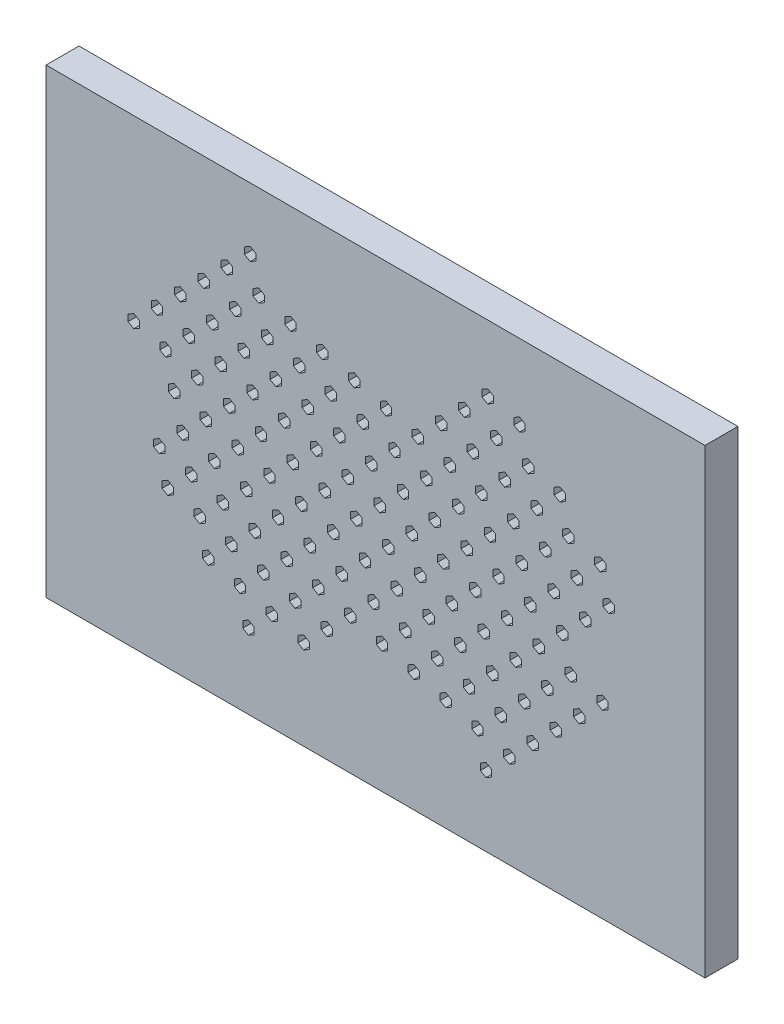
from build123d import *

# Parameters (mm, degrees)
SKICA1_W                 = 200
SKICA1_H                 = 140
P_IDAT_VYSUNUT_M1_DEPTH  = 10
ODEBRAT_VYSUNUT_M2_REACH = 124.474
POLE_VYPLN_N_M1_DEPTH    = 10


# Read off the part's stored shape, not the designer's step: Pole vyplněním1
with BuildPart() as part:
    # Skica1 → Přidat vysunutím1 (new body)
    with BuildSketch(Plane.XY):
        Rectangle(SKICA1_W, SKICA1_H)
    extrude(amount=P_IDAT_VYSUNUT_M1_DEPTH)

    # Skica3 → Odebrat vysunutím2 (cut, up to next)
    with BuildSketch(Plane.XY.offset(10), mode=Mode.PRIVATE) as odebrat_vysunut_m2_sk1:
        Polygon((-71.673091376, 14.9613897), (-71.673091376, 16.9613897), (-73.405142184, 17.9613897), (-75.137192991, 16.9613897), (-75.137192991, 14.9613897), (-73.405142184, 13.9613897), align=None)
    odebrat_vysunut_m2_tool1 = extrude(odebrat_vysunut_m2_sk1.sketch, amount=-ODEBRAT_VYSUNUT_M2_REACH, mode=Mode.PRIVATE) & part.part
    add(odebrat_vysunut_m2_tool1.solids().sort_by_distance((-73.405142, 15.96139, 10))[0], mode=Mode.SUBTRACT)

    # Pole vyplněním1 outline → Pole vyplněním1 (cut)
    with BuildSketch(Plane.XY):
        Polygon((-64.784431187, -23.675643352), (-63.05238038, -24.675643352), (-61.320329572, -23.675643352), (-61.320329572, -21.675643352), (-63.05238038, -20.675643352), (-64.784431187, -21.675643352), align=None)
        Polygon((66.46998696, 21.846633798), (68.202037767, 20.846633798), (69.934088575, 21.846633798), (69.934088575, 23.846633798), (68.202037767, 24.846633798), (66.46998696, 23.846633798), align=None)
        Polygon((-26.840901677, 2.020437445), (-25.108850869, 1.020437445), (-23.376800062, 2.020437445), (-23.376800062, 4.020437445), (-25.108850869, 5.020437445), (-26.840901677, 4.020437445), align=None)
        Polygon((-29.429092128, 11.679695708), (-27.69704132, 10.679695708), (-25.964990513, 11.679695708), (-25.964990513, 13.679695708), (-27.69704132, 14.679695708), (-29.429092128, 13.679695708), align=None)
        Polygon((-32.017282579, 21.338953971), (-30.285231771, 20.338953971), (-28.553180964, 21.338953971), (-28.553180964, 23.338953971), (-30.285231771, 24.338953971), (-32.017282579, 23.338953971), align=None)
        Polygon((-34.60547303, 30.998212233), (-32.873422222, 29.998212233), (-31.141371415, 30.998212233), (-31.141371415, 32.998212233), (-32.873422222, 33.998212233), (-34.60547303, 32.998212233), align=None)
        Polygon((-37.193663481, 40.657470496), (-35.461612673, 39.657470496), (-33.729561866, 40.657470496), (-33.729561866, 42.657470496), (-35.461612673, 43.657470496), (-37.193663481, 42.657470496), align=None)
        Polygon((-39.781853932, 50.316728759), (-38.049803124, 49.316728759), (-36.317752317, 50.316728759), (-36.317752317, 52.316728759), (-38.049803124, 53.316728759), (-39.781853932, 52.316728759), align=None)
        Polygon((-9.417072061, -29.545527795), (-7.685021253, -30.545527795), (-5.952970446, -29.545527795), (-5.952970446, -27.545527795), (-7.685021253, -26.545527795), (-9.417072061, -27.545527795), align=None)
        Polygon((-12.005262512, -19.886269532), (-10.273211704, -20.886269532), (-8.541160897, -19.886269532), (-8.541160897, -17.886269532), (-10.273211704, -16.886269532), (-12.005262512, -17.886269532), align=None)
        Polygon((-24.252711226, -7.638820818), (-22.520660418, -8.638820818), (-20.788609611, -7.638820818), (-20.788609611, -5.638820818), (-22.520660418, -4.638820818), (-24.252711226, -5.638820818), align=None)
        Polygon((-21.664520775, -17.298079081), (-19.932469967, -18.298079081), (-18.20041916, -17.298079081), (-18.20041916, -15.298079081), (-19.932469967, -14.298079081), (-21.664520775, -15.298079081), align=None)
        Polygon((-19.076330324, -26.957337344), (-17.344279516, -27.957337344), (-15.612228709, -26.957337344), (-15.612228709, -24.957337344), (-17.344279516, -23.957337344), (-19.076330324, -24.957337344), align=None)
        Polygon((-16.488139873, -36.616595607), (-14.756089065, -37.616595607), (-13.024038258, -36.616595607), (-13.024038258, -34.616595607), (-14.756089065, -33.616595607), (-16.488139873, -34.616595607), align=None)
        Polygon((-46.852921744, 43.245660947), (-45.120870936, 42.245660947), (-43.388820129, 43.245660947), (-43.388820129, 45.245660947), (-45.120870936, 46.245660947), (-46.852921744, 45.245660947), align=None)
        Polygon((-44.264731293, 33.586402684), (-42.532680485, 32.586402684), (-40.800629678, 33.586402684), (-40.800629678, 35.586402684), (-42.532680485, 36.586402684), (-44.264731293, 35.586402684), align=None)
        Polygon((-41.676540842, 23.927144422), (-39.944490034, 22.927144422), (-38.212439227, 23.927144422), (-38.212439227, 25.927144422), (-39.944490034, 26.927144422), (-41.676540842, 25.927144422), align=None)
        Polygon((-39.088350391, 14.267886159), (-37.356299583, 13.267886159), (-35.624248776, 14.267886159), (-35.624248776, 16.267886159), (-37.356299583, 17.267886159), (-39.088350391, 16.267886159), align=None)
        Polygon((-4.9341947, -12.81520172), (-3.202143893, -13.81520172), (-1.470093085, -12.81520172), (-1.470093085, -10.81520172), (-3.202143893, -9.81520172), (-4.9341947, -10.81520172), align=None)
        Polygon((-7.522385151, -3.155943457), (-5.790334344, -4.155943457), (-4.058283536, -3.155943457), (-4.058283536, -1.155943457), (-5.790334344, -0.155943457), (-7.522385151, -1.155943457), align=None)
        Polygon((-10.110575602, 6.503314806), (-8.378524795, 5.503314806), (-6.646473987, 6.503314806), (-6.646473987, 8.503314806), (-8.378524795, 9.503314806), (-10.110575602, 8.503314806), align=None)
        Polygon((-12.698766053, 16.162573068), (-10.966715246, 15.162573068), (-9.234664438, 16.162573068), (-9.234664438, 18.162573068), (-10.966715246, 19.162573068), (-12.698766053, 18.162573068), align=None)
        Polygon((-15.286956504, 25.821831331), (-13.554905697, 24.821831331), (-11.822854889, 25.821831331), (-11.822854889, 27.821831331), (-13.554905697, 28.821831331), (-15.286956504, 27.821831331), align=None)
        Polygon((-17.875146955, 35.481089594), (-16.143096148, 34.481089594), (-14.41104534, 35.481089594), (-14.41104534, 37.481089594), (-16.143096148, 38.481089594), (-17.875146955, 37.481089594), align=None)
        Polygon((9.901444465, -34.721908697), (11.633495272, -35.721908697), (13.36554608, -34.721908697), (13.36554608, -32.721908697), (11.633495272, -31.721908697), (9.901444465, -32.721908697), align=None)
        Polygon((7.313254014, -25.062650434), (9.045304821, -26.062650434), (10.777355629, -25.062650434), (10.777355629, -23.062650434), (9.045304821, -22.062650434), (7.313254014, -23.062650434), align=None)
        Polygon((-14.593452963, -10.227011269), (-12.861402155, -11.227011269), (-11.129351348, -10.227011269), (-11.129351348, -8.227011269), (-12.861402155, -7.227011269), (-14.593452963, -8.227011269), align=None)
        Polygon((-17.181643414, -0.567753006), (-15.449592606, -1.567753006), (-13.717541799, -0.567753006), (-13.717541799, 1.432246994), (-15.449592606, 2.432246994), (-17.181643414, 1.432246994), align=None)
        Polygon((-19.769833865, 9.091505257), (-18.037783058, 8.091505257), (-16.30573225, 9.091505257), (-16.30573225, 11.091505257), (-18.037783058, 12.091505257), (-19.769833865, 11.091505257), align=None)
        Polygon((-22.358024316, 18.750763519), (-20.625973509, 17.750763519), (-18.893922701, 18.750763519), (-18.893922701, 20.750763519), (-20.625973509, 21.750763519), (-22.358024316, 20.750763519), align=None)
        Polygon((-24.946214767, 28.410021782), (-23.21416396, 27.410021782), (-21.482113152, 28.410021782), (-21.482113152, 30.410021782), (-23.21416396, 31.410021782), (-24.946214767, 30.410021782), align=None)
        Polygon((-27.534405218, 38.069280045), (-25.802354411, 37.069280045), (-24.070303603, 38.069280045), (-24.070303603, 40.069280045), (-25.802354411, 41.069280045), (-27.534405218, 40.069280045), align=None)
        Polygon((0.242186202, -32.133718246), (1.974237009, -33.133718246), (3.706287817, -32.133718246), (3.706287817, -30.133718246), (1.974237009, -29.133718246), (0.242186202, -30.133718246), align=None)
        Polygon((-2.346004249, -22.474459983), (-0.613953442, -23.474459983), (1.118097366, -22.474459983), (1.118097366, -20.474459983), (-0.613953442, -19.474459983), (-2.346004249, -20.474459983), align=None)
        Polygon((-58.406866917, 19.444267061), (-56.674816109, 18.444267061), (-54.942765301, 19.444267061), (-54.942765301, 21.444267061), (-56.674816109, 22.444267061), (-58.406866917, 21.444267061), align=None)
        Polygon((-55.818676466, 9.785008798), (-54.086625658, 8.785008798), (-52.35457485, 9.785008798), (-52.35457485, 11.785008798), (-54.086625658, 12.785008798), (-55.818676466, 11.785008798), align=None)
        Polygon((-53.230486015, 0.125750535), (-51.498435207, -0.874249465), (-49.766384399, 0.125750535), (-49.766384399, 2.125750535), (-51.498435207, 3.125750535), (-53.230486015, 2.125750535), align=None)
        Polygon((-50.642295564, -9.533507728), (-48.910244756, -10.533507728), (-47.178193948, -9.533507728), (-47.178193948, -7.533507728), (-48.910244756, -6.533507728), (-50.642295564, -7.533507728), align=None)
        Polygon((-48.054105113, -19.192765991), (-46.322054305, -20.192765991), (-44.590003497, -19.192765991), (-44.590003497, -17.192765991), (-46.322054305, -16.192765991), (-48.054105113, -17.192765991), align=None)
        Polygon((-45.465914662, -28.852024254), (-43.733863854, -29.852024254), (-42.001813046, -28.852024254), (-42.001813046, -26.852024254), (-43.733863854, -25.852024254), (-45.465914662, -26.852024254), align=None)
        Polygon((-42.87772421, -38.511282517), (-41.145673403, -39.511282517), (-39.413622595, -38.511282517), (-39.413622595, -36.511282517), (-41.145673403, -35.511282517), (-42.87772421, -36.511282517), align=None)
        Polygon((-40.289533759, -48.17054078), (-38.557482952, -49.17054078), (-36.825432144, -48.17054078), (-36.825432144, -46.17054078), (-38.557482952, -45.17054078), (-40.289533759, -46.17054078), align=None)
        Polygon((-68.06612518, 22.032457512), (-66.334074372, 21.032457512), (-64.602023564, 22.032457512), (-64.602023564, 24.032457512), (-66.334074372, 25.032457512), (-68.06612518, 24.032457512), align=None)
        Polygon((-65.477934728, 12.373199249), (-63.745883921, 11.373199249), (-62.013833113, 12.373199249), (-62.013833113, 14.373199249), (-63.745883921, 15.373199249), (-65.477934728, 14.373199249), align=None)
        Polygon((-62.889744277, 2.713940986), (-61.15769347, 1.713940986), (-59.425642662, 2.713940986), (-59.425642662, 4.713940986), (-61.15769347, 5.713940986), (-62.889744277, 4.713940986), align=None)
        Polygon((-60.301553826, -6.945317277), (-58.569503019, -7.945317277), (-56.837452211, -6.945317277), (-56.837452211, -4.945317277), (-58.569503019, -3.945317277), (-60.301553826, -4.945317277), align=None)
        Polygon((-67.372621638, -14.016385089), (-65.640570831, -15.016385089), (-63.908520023, -14.016385089), (-63.908520023, -12.016385089), (-65.640570831, -11.016385089), (-67.372621638, -12.016385089), align=None)
        Polygon((-52.536982473, -35.923092066), (-50.804931666, -36.923092066), (-49.072880858, -35.923092066), (-49.072880858, -33.923092066), (-50.804931666, -32.923092066), (-52.536982473, -33.923092066), align=None)
        Polygon((-55.125172924, -26.263833803), (-53.393122117, -27.263833803), (-51.661071309, -26.263833803), (-51.661071309, -24.263833803), (-53.393122117, -23.263833803), (-55.125172924, -24.263833803), align=None)
        Polygon((-57.713363375, -16.60457554), (-55.981312568, -17.60457554), (-54.24926176, -16.60457554), (-54.24926176, -14.60457554), (-55.981312568, -13.60457554), (-57.713363375, -14.60457554), align=None)
        Polygon((-51.335799105, 26.515334873), (-49.603748297, 25.515334873), (-47.87169749, 26.515334873), (-47.87169749, 28.515334873), (-49.603748297, 29.515334873), (-51.335799105, 28.515334873), align=None)
        Polygon((-53.923989556, 36.174593135), (-52.191938748, 35.174593135), (-50.459887941, 36.174593135), (-50.459887941, 38.174593135), (-52.191938748, 39.174593135), (-53.923989556, 38.174593135), align=None)
        Polygon((-23.559207685, -43.687663419), (-21.827156877, -44.687663419), (-20.09510607, -43.687663419), (-20.09510607, -41.687663419), (-21.827156877, -40.687663419), (-23.559207685, -41.687663419), align=None)
        Polygon((-26.147398136, -34.028405156), (-24.415347328, -35.028405156), (-22.683296521, -34.028405156), (-22.683296521, -32.028405156), (-24.415347328, -31.028405156), (-26.147398136, -32.028405156), align=None)
        Polygon((-28.735588587, -24.369146893), (-27.003537779, -25.369146893), (-25.271486972, -24.369146893), (-25.271486972, -22.369146893), (-27.003537779, -21.369146893), (-28.735588587, -22.369146893), align=None)
        Polygon((-31.323779038, -14.70988863), (-29.59172823, -15.70988863), (-27.859677423, -14.70988863), (-27.859677423, -12.70988863), (-29.59172823, -11.70988863), (-31.323779038, -12.70988863), align=None)
        Polygon((-33.911969489, -5.050630367), (-32.179918681, -6.050630367), (-30.447867874, -5.050630367), (-30.447867874, -3.050630367), (-32.179918681, -2.050630367), (-33.911969489, -3.050630367), align=None)
        Polygon((-36.50015994, 4.608627896), (-34.768109132, 3.608627896), (-33.036058325, 4.608627896), (-33.036058325, 6.608627896), (-34.768109132, 7.608627896), (-36.50015994, 6.608627896), align=None)
        Polygon((-38.39484685, -21.780956442), (-36.662796042, -22.780956442), (-34.930745235, -21.780956442), (-34.930745235, -19.780956442), (-36.662796042, -18.780956442), (-38.39484685, -19.780956442), align=None)
        Polygon((-35.806656399, -31.440214705), (-34.074605591, -32.440214705), (-32.342554783, -31.440214705), (-32.342554783, -29.440214705), (-34.074605591, -28.440214705), (-35.806656399, -29.440214705), align=None)
        Polygon((-33.218465948, -41.099472968), (-31.48641514, -42.099472968), (-29.754364332, -41.099472968), (-29.754364332, -39.099472968), (-31.48641514, -38.099472968), (-33.218465948, -39.099472968), align=None)
        Polygon((-60.995057368, 29.103525324), (-59.26300656, 28.103525324), (-57.530955753, 29.103525324), (-57.530955753, 31.103525324), (-59.26300656, 32.103525324), (-60.995057368, 31.103525324), align=None)
        Polygon((-40.983037301, -12.121698179), (-39.250986493, -13.121698179), (-37.518935686, -12.121698179), (-37.518935686, -10.121698179), (-39.250986493, -9.121698179), (-40.983037301, -10.121698179), align=None)
        Polygon((-43.571227752, -2.462439916), (-41.839176944, -3.462439916), (-40.107126137, -2.462439916), (-40.107126137, -0.462439916), (-41.839176944, 0.537560084), (-43.571227752, -0.462439916), align=None)
        Polygon((-46.159418203, 7.196818347), (-44.427367395, 6.196818347), (-42.695316588, 7.196818347), (-42.695316588, 9.196818347), (-44.427367395, 10.196818347), (-46.159418203, 9.196818347), align=None)
        Polygon((-48.747608654, 16.85607661), (-47.015557846, 15.85607661), (-45.283507039, 16.85607661), (-45.283507039, 18.85607661), (-47.015557846, 19.85607661), (-48.747608654, 18.85607661), align=None)
        Polygon((47.844973975, -9.025827901), (49.577024783, -10.025827901), (51.30907559, -9.025827901), (51.30907559, -7.025827901), (49.577024783, -6.025827901), (47.844973975, -7.025827901), align=None)
        Polygon((50.433164426, -18.685086163), (52.165215234, -19.685086163), (53.897266041, -18.685086163), (53.897266041, -16.685086163), (52.165215234, -15.685086163), (50.433164426, -16.685086163), align=None)
        Polygon((53.021354877, -28.344344426), (54.753405685, -29.344344426), (56.485456492, -28.344344426), (56.485456492, -26.344344426), (54.753405685, -25.344344426), (53.021354877, -26.344344426), align=None)
        Polygon((25.244763457, 41.858653865), (26.976814265, 40.858653865), (28.708865072, 41.858653865), (28.708865072, 43.858653865), (26.976814265, 44.858653865), (25.244763457, 43.858653865), align=None)
        Polygon((45.256783524, 0.633430362), (46.988834332, -0.366569638), (48.720885139, 0.633430362), (48.720885139, 2.633430362), (46.988834332, 3.633430362), (45.256783524, 2.633430362), align=None)
        Polygon((42.668593073, 10.292688625), (44.400643881, 9.292688625), (46.132694688, 10.292688625), (46.132694688, 12.292688625), (44.400643881, 13.292688625), (42.668593073, 12.292688625), align=None)
        Polygon((40.080402622, 19.951946888), (41.81245343, 18.951946888), (43.544504237, 19.951946888), (43.544504237, 21.951946888), (41.81245343, 22.951946888), (40.080402622, 21.951946888), align=None)
        Polygon((37.492212171, 29.611205151), (39.224262979, 28.611205151), (40.956313786, 29.611205151), (40.956313786, 31.611205151), (39.224262979, 32.611205151), (37.492212171, 31.611205151), align=None)
        Polygon((27.832953908, 32.199395602), (29.565004716, 31.199395602), (31.297055523, 32.199395602), (31.297055523, 34.199395602), (29.565004716, 35.199395602), (27.832953908, 34.199395602), align=None)
        Polygon((30.421144359, 22.540137339), (32.153195167, 21.540137339), (33.885245974, 22.540137339), (33.885245974, 24.540137339), (32.153195167, 25.540137339), (30.421144359, 24.540137339), align=None)
        Polygon((33.00933481, 12.880879076), (34.741385618, 11.880879076), (36.473436425, 12.880879076), (36.473436425, 14.880879076), (34.741385618, 15.880879076), (33.00933481, 14.880879076), align=None)
        Polygon((35.597525261, 3.221620813), (37.329576069, 2.221620813), (39.061626876, 3.221620813), (39.061626876, 5.221620813), (37.329576069, 6.221620813), (35.597525261, 5.221620813), align=None)
        Polygon((38.185715712, -6.43763745), (39.91776652, -7.43763745), (41.649817327, -6.43763745), (41.649817327, -4.43763745), (39.91776652, -3.43763745), (38.185715712, -4.43763745), align=None)
        Polygon((40.773906163, -16.096895712), (42.505956971, -17.096895712), (44.238007778, -16.096895712), (44.238007778, -14.096895712), (42.505956971, -13.096895712), (40.773906163, -14.096895712), align=None)
        Polygon((43.362096614, -25.756153975), (45.094147422, -26.756153975), (46.826198229, -25.756153975), (46.826198229, -23.756153975), (45.094147422, -22.756153975), (43.362096614, -23.756153975), align=None)
        Polygon((45.950287065, -35.415412238), (47.682337873, -36.415412238), (49.41438868, -35.415412238), (49.41438868, -33.415412238), (47.682337873, -32.415412238), (45.950287065, -33.415412238), align=None)
        Polygon((44.563279983, 36.682272963), (46.29533079, 35.682272963), (48.027381598, 36.682272963), (48.027381598, 38.682272963), (46.29533079, 39.682272963), (44.563279983, 38.682272963), align=None)
        Polygon((41.975089532, 46.341531226), (43.707140339, 45.341531226), (45.439191147, 46.341531226), (45.439191147, 48.341531226), (43.707140339, 49.341531226), (41.975089532, 48.341531226), align=None)
        Polygon((67.163490501, -14.202208803), (68.895541309, -15.202208803), (70.627592116, -14.202208803), (70.627592116, -12.202208803), (68.895541309, -11.202208803), (67.163490501, -12.202208803), align=None)
        Polygon((61.987109599, 5.116307723), (63.719160406, 4.116307723), (65.451211214, 5.116307723), (65.451211214, 7.116307723), (63.719160406, 8.116307723), (61.987109599, 7.116307723), align=None)
        Polygon((69.058177411, 12.187375535), (70.790228218, 11.187375535), (72.522279026, 12.187375535), (72.522279026, 14.187375535), (70.790228218, 15.187375535), (69.058177411, 14.187375535), align=None)
        Polygon((54.222538246, 34.094082512), (55.954589053, 33.094082512), (57.686639861, 34.094082512), (57.686639861, 36.094082512), (55.954589053, 37.094082512), (54.222538246, 36.094082512), align=None)
        Polygon((56.810728697, 24.434824249), (58.542779504, 23.434824249), (60.274830312, 24.434824249), (60.274830312, 26.434824249), (58.542779504, 27.434824249), (56.810728697, 26.434824249), align=None)
        Polygon((59.398919148, 14.775565986), (61.130969955, 13.775565986), (62.863020763, 14.775565986), (62.863020763, 16.775565986), (61.130969955, 17.775565986), (59.398919148, 16.775565986), align=None)
        Polygon((34.90402172, 39.270463414), (36.636072528, 38.270463414), (38.368123335, 39.270463414), (38.368123335, 41.270463414), (36.636072528, 42.270463414), (34.90402172, 41.270463414), align=None)
        Polygon((32.315831269, 48.929721677), (34.047882077, 47.929721677), (35.779932884, 48.929721677), (35.779932884, 50.929721677), (34.047882077, 51.929721677), (32.315831269, 50.929721677), align=None)
        Polygon((60.092422689, -21.273276614), (61.824473497, -22.273276614), (63.556524304, -21.273276614), (63.556524304, -19.273276614), (61.824473497, -18.273276614), (60.092422689, -19.273276614), align=None)
        Polygon((57.504232238, -11.614018352), (59.236283046, -12.614018352), (60.968333853, -11.614018352), (60.968333853, -9.614018352), (59.236283046, -8.614018352), (57.504232238, -9.614018352), align=None)
        Polygon((54.916041787, -1.954760089), (56.648092595, -2.954760089), (58.380143402, -1.954760089), (58.380143402, 0.045239911), (56.648092595, 1.045239911), (54.916041787, 0.045239911), align=None)
        Polygon((52.327851336, 7.704498174), (54.059902144, 6.704498174), (55.791952951, 7.704498174), (55.791952951, 9.704498174), (54.059902144, 10.704498174), (52.327851336, 9.704498174), align=None)
        Polygon((49.739660885, 17.363756437), (51.471711693, 16.363756437), (53.2037625, 17.363756437), (53.2037625, 19.363756437), (51.471711693, 20.363756437), (49.739660885, 19.363756437), align=None)
        Polygon((47.151470434, 27.0230147), (48.883521242, 26.0230147), (50.615572049, 27.0230147), (50.615572049, 29.0230147), (48.883521242, 30.0230147), (47.151470434, 29.0230147), align=None)
        Polygon((14.384321826, -17.991582622), (16.116372633, -18.991582622), (17.848423441, -17.991582622), (17.848423441, -15.991582622), (16.116372633, -14.991582622), (14.384321826, -15.991582622), align=None)
        Polygon((11.796131375, -8.332324359), (13.528182182, -9.332324359), (15.26023299, -8.332324359), (15.26023299, -6.332324359), (13.528182182, -5.332324359), (11.796131375, -6.332324359), align=None)
        Polygon((9.207940924, 1.326933904), (10.939991731, 0.326933904), (12.672042539, 1.326933904), (12.672042539, 3.326933904), (10.939991731, 4.326933904), (9.207940924, 3.326933904), align=None)
        Polygon((6.619750473, 10.986192166), (8.35180128, 9.986192166), (10.083852088, 10.986192166), (10.083852088, 12.986192166), (8.35180128, 13.986192166), (6.619750473, 12.986192166), align=None)
        Polygon((4.031560022, 20.645450429), (5.763610829, 19.645450429), (7.495661637, 20.645450429), (7.495661637, 22.645450429), (5.763610829, 23.645450429), (4.031560022, 22.645450429), align=None)
        Polygon((1.443369571, 30.304708692), (3.175420378, 29.304708692), (4.907471186, 30.304708692), (4.907471186, 32.304708692), (3.175420378, 33.304708692), (1.443369571, 32.304708692), align=None)
        Polygon((31.808151442, -49.557547862), (33.540202249, -50.557547862), (35.272253057, -49.557547862), (35.272253057, -47.557547862), (33.540202249, -46.557547862), (31.808151442, -47.557547862), align=None)
        Polygon((29.219960991, -39.898289599), (30.952011798, -40.898289599), (32.684062606, -39.898289599), (32.684062606, -37.898289599), (30.952011798, -36.898289599), (29.219960991, -37.898289599), align=None)
        Polygon((4.725063563, -15.403392171), (6.45711437, -16.403392171), (8.189165178, -15.403392171), (8.189165178, -13.403392171), (6.45711437, -12.403392171), (4.725063563, -13.403392171), align=None)
        Polygon((2.136873112, -5.744133908), (3.868923919, -6.744133908), (5.600974727, -5.744133908), (5.600974727, -3.744133908), (3.868923919, -2.744133908), (2.136873112, -3.744133908), align=None)
        Polygon((-0.451317339, 3.915124355), (1.280733468, 2.915124355), (3.012784276, 3.915124355), (3.012784276, 5.915124355), (1.280733468, 6.915124355), (-0.451317339, 5.915124355), align=None)
        Polygon((-3.03950779, 13.574382617), (-1.307456983, 12.574382617), (0.424593825, 13.574382617), (0.424593825, 15.574382617), (-1.307456983, 16.574382617), (-3.03950779, 15.574382617), align=None)
        Polygon((-5.627698241, 23.23364088), (-3.895647434, 22.23364088), (-2.163596626, 23.23364088), (-2.163596626, 25.23364088), (-3.895647434, 26.23364088), (-5.627698241, 25.23364088), align=None)
        Polygon((-8.215888692, 32.892899143), (-6.483837885, 31.892899143), (-4.751787077, 32.892899143), (-4.751787077, 34.892899143), (-6.483837885, 35.892899143), (-8.215888692, 34.892899143), align=None)
        Polygon((19.560702728, -37.310099148), (21.292753535, -38.310099148), (23.024804343, -37.310099148), (23.024804343, -35.310099148), (21.292753535, -34.310099148), (19.560702728, -35.310099148), align=None)
        Polygon((16.972512277, -27.650840885), (18.704563084, -28.650840885), (20.436613892, -27.650840885), (20.436613892, -25.650840885), (18.704563084, -24.650840885), (16.972512277, -25.650840885), align=None)
        Polygon((18.173695645, 34.787586053), (19.905746453, 33.787586053), (21.63779726, 34.787586053), (21.63779726, 36.787586053), (19.905746453, 37.787586053), (18.173695645, 36.787586053), align=None)
        Polygon((20.761886096, 25.12832779), (22.493936904, 24.12832779), (24.225987711, 25.12832779), (24.225987711, 27.12832779), (22.493936904, 28.12832779), (20.761886096, 27.12832779), align=None)
        Polygon((23.350076547, 15.469069527), (25.082127355, 14.469069527), (26.814178162, 15.469069527), (26.814178162, 17.469069527), (25.082127355, 18.469069527), (23.350076547, 17.469069527), align=None)
        Polygon((25.938266998, 5.809811264), (27.670317806, 4.809811264), (29.402368613, 5.809811264), (29.402368613, 7.809811264), (27.670317806, 8.809811264), (25.938266998, 7.809811264), align=None)
        Polygon((28.526457449, -3.849446999), (30.258508257, -4.849446999), (31.990559065, -3.849446999), (31.990559065, -1.849446999), (30.258508257, -0.849446999), (28.526457449, -1.849446999), align=None)
        Polygon((31.1146479, -13.508705261), (32.846698708, -14.508705261), (34.578749516, -13.508705261), (34.578749516, -11.508705261), (32.846698708, -10.508705261), (31.1146479, -11.508705261), align=None)
        Polygon((33.702838351, -23.167963524), (35.434889159, -24.167963524), (37.166939967, -23.167963524), (37.166939967, -21.167963524), (35.434889159, -20.167963524), (33.702838351, -21.167963524), align=None)
        Polygon((36.291028802, -32.827221787), (38.02307961, -33.827221787), (39.755130418, -32.827221787), (39.755130418, -30.827221787), (38.02307961, -29.827221787), (36.291028802, -30.827221787), align=None)
        Polygon((26.63177054, -30.239031336), (28.363821347, -31.239031336), (30.095872155, -30.239031336), (30.095872155, -28.239031336), (28.363821347, -27.239031336), (26.63177054, -28.239031336), align=None)
        Polygon((24.043580089, -20.579773073), (25.775630896, -21.579773073), (27.507681704, -20.579773073), (27.507681704, -18.579773073), (25.775630896, -17.579773073), (24.043580089, -18.579773073), align=None)
        Polygon((21.455389638, -10.92051481), (23.187440445, -11.92051481), (24.919491253, -10.92051481), (24.919491253, -8.92051481), (23.187440445, -7.92051481), (21.455389638, -8.92051481), align=None)
        Polygon((18.867199186, -1.261256548), (20.599249994, -2.261256548), (22.331300802, -1.261256548), (22.331300802, 0.738743452), (20.599249994, 1.738743452), (18.867199186, 0.738743452), align=None)
        Polygon((38.879219253, -42.48648005), (40.611270061, -43.48648005), (42.343320869, -42.48648005), (42.343320869, -40.48648005), (40.611270061, -39.48648005), (38.879219253, -40.48648005), align=None)
        Polygon((11.102627833, 27.716518241), (12.834678641, 26.716518241), (14.566729449, 27.716518241), (14.566729449, 29.716518241), (12.834678641, 30.716518241), (11.102627833, 29.716518241), align=None)
        Polygon((13.690818284, 18.057259978), (15.422869092, 17.057259978), (17.1549199, 18.057259978), (17.1549199, 20.057259978), (15.422869092, 21.057259978), (13.690818284, 20.057259978), align=None)
        Polygon((16.279008735, 8.398001715), (18.011059543, 7.398001715), (19.743110351, 8.398001715), (19.743110351, 10.398001715), (18.011059543, 11.398001715), (16.279008735, 10.398001715), align=None)
    extrude(amount=POLE_VYPLN_N_M1_DEPTH, mode=Mode.SUBTRACT)


solid = part.part
